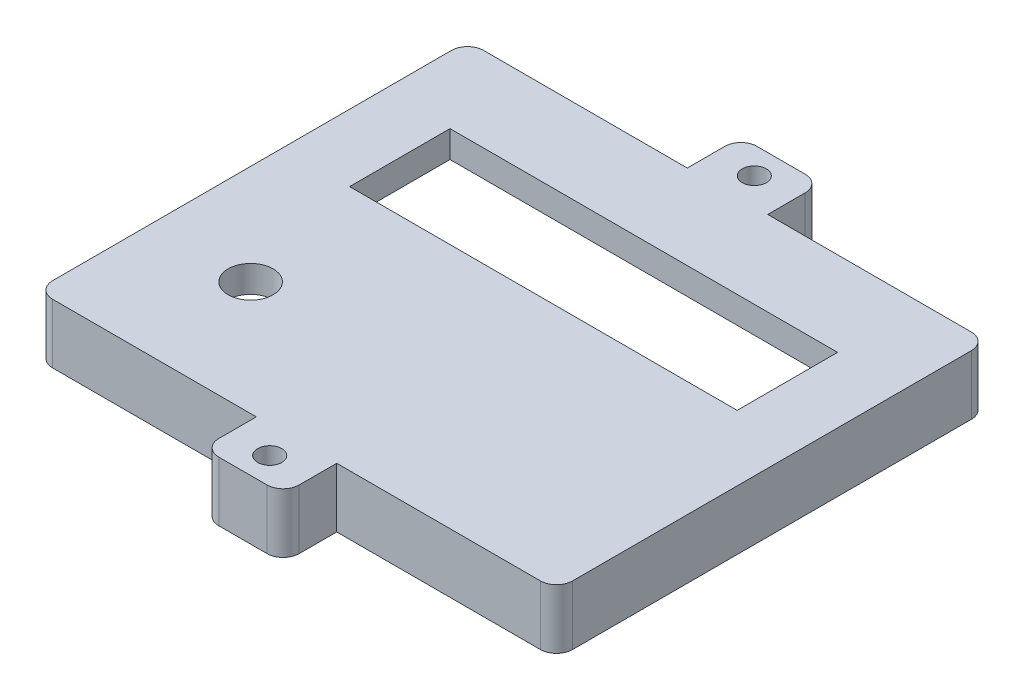
from build123d import *

# Parameters (mm, degrees)
SKETCH1_W           = 97
SKETCH1_H           = 80.401218893
BOSS_EXTRUDE1_DEPTH = 12.6
CUT_EXTRUDE1_REACH  = 69.973
SKETCH2_R           = 4.2
SKETCH2_W           = 72.3
SKETCH2_H           = 18.735180651
CUT_EXTRUDE2_START  = -5
CUT_EXTRUDE2_DEPTH  = 10
SKETCH6_W           = 97
SKETCH6_H           = 80.401218893
CUT_EXTRUDE3_DEPTH  = 1.5
FILLET1_R           = 3
SKETCH7_W           = 15
SKETCH7_H           = 11.1
BOSS_EXTRUDE2_DEPTH = 10
FILLET2_R           = 3
SKETCH8_W           = 15
SKETCH8_H           = 11.1
BOSS_EXTRUDE3_DEPTH = 10
FILLET3_R           = 3
CUT_EXTRUDE4_REACH  = 76.569
SKETCH9_R           = 2.25


with BuildPart() as part:
    # Sketch1 → Boss-Extrude1 (new body)
    with BuildSketch(Plane(origin=(0, 0, 0), x_dir=(1, 0, 0), z_dir=(0, 1, 0))):
        with Locations((3.433898335, -1.804923378)):
            Rectangle(SKETCH1_W, SKETCH1_H)
    extrude(amount=BOSS_EXTRUDE1_DEPTH)

    # Sketch2 → Cut-Extrude1 (cut, up to next)
    with BuildSketch(Plane(origin=(0, 12.6, 0), x_dir=(1, 0, 0), z_dir=(0, 1, 0)), mode=Mode.PRIVATE) as cut_extrude1_sk1:
        with Locations((-26.416101665, -20.718350566)):
            Circle(SKETCH2_R)
    cut_extrude1_tool1 = extrude(cut_extrude1_sk1.sketch, amount=-CUT_EXTRUDE1_REACH, mode=Mode.PRIVATE) & part.part
    # Sketch2 → Cut-Extrude1 (cut, up to next)
    with BuildSketch(Plane(origin=(0, 12.6, 0), x_dir=(1, 0, 0), z_dir=(0, 1, 0)), mode=Mode.PRIVATE) as cut_extrude1_sk2:
        with Locations((3.583898335, 13.264059108)):
            Rectangle(SKETCH2_W, SKETCH2_H)
    cut_extrude1_tool2 = extrude(cut_extrude1_sk2.sketch, amount=-CUT_EXTRUDE1_REACH, mode=Mode.PRIVATE) & part.part
    add(cut_extrude1_tool1.solids().sort_by_distance((-26.416102, 12.6, 20.718351))[0], mode=Mode.SUBTRACT)
    add(cut_extrude1_tool2.solids().sort_by_distance((3.583898, 12.6, -13.264059))[0], mode=Mode.SUBTRACT)

    # Sketch3 → Cut-Extrude2 (cut)
    with BuildSketch(Plane(origin=(0, 12.6, 0), x_dir=(1, 0, 0), z_dir=(0, 1, 0)).offset(CUT_EXTRUDE2_START)):
        with BuildLine():
            Line((-41.366101665, 31.831649434), (-41.366101665, -34.168350566))
            ThreePointArc((-41.366101665, -34.168350566), (-40.926761836, -35.229010737), (-39.866101665, -35.668350566))
            Line((-39.866101665, -35.668350566), (46.133898335, -35.668350566))
            ThreePointArc((46.133898335, -35.668350566), (47.194558507, -35.229010737), (47.633898335, -34.168350566))
            Line((47.633898335, -34.168350566), (47.633898335, 31.831649434))
            ThreePointArc((47.633898335, 31.831649434), (47.194558507, 32.892309606), (46.133898335, 33.331649434))
            Line((46.133898335, 33.331649434), (-39.866101665, 33.331649434))
            ThreePointArc((-39.866101665, 33.331649434), (-40.926761836, 32.892309606), (-41.366101665, 31.831649434))
        make_face()
    extrude(amount=-CUT_EXTRUDE2_DEPTH, mode=Mode.SUBTRACT)

    # Sketch6 → Cut-Extrude3 (cut)
    with BuildSketch(Plane.XZ):
        with Locations((3.433898335, 1.804923378)):
            Rectangle(SKETCH6_W, SKETCH6_H)
        with BuildLine():
            Line((-39.866101665, -34.531649434), (46.133898335, -34.531649434))
            ThreePointArc((46.133898335, -34.531649434), (48.043086645, -33.740837743), (48.833898335, -31.831649434))
            Line((48.833898335, -31.831649434), (48.833898335, 34.168350566))
            ThreePointArc((48.833898335, 34.168350566), (48.043086645, 36.077538875), (46.133898335, 36.868350566))
            Line((46.133898335, 36.868350566), (-39.866101665, 36.868350566))
            ThreePointArc((-39.866101665, 36.868350566), (-41.775289974, 36.077538875), (-42.566101665, 34.168350566))
            Line((-42.566101665, 34.168350566), (-42.566101665, -31.831649434))
            ThreePointArc((-42.566101665, -31.831649434), (-41.775289974, -33.740837743), (-39.866101665, -34.531649434))
        make_face(mode=Mode.SUBTRACT)
    extrude(amount=-CUT_EXTRUDE3_DEPTH, mode=Mode.SUBTRACT)

    # Fillet1
    fillet1_edges = [part.edges().sort_by_distance(p)[0] for p in [
        (51.933898335, 7.05, -38.395686068),
        (-45.066101665, 7.05, -38.395686068),
        (-45.066101665, 7.05, 42.005532825),
        (51.933898335, 7.05, 42.005532825),
    ]]
    fillet(fillet1_edges, radius=FILLET1_R)

    # Sketch7 → Boss-Extrude2 (add)
    with BuildSketch(Plane.XY.offset(42.005532825)):
        with Locations((3.433898335, 7.05)):
            Rectangle(SKETCH7_W, SKETCH7_H)
    extrude(amount=BOSS_EXTRUDE2_DEPTH)

    # Fillet2
    fillet2_edges = [part.edges().sort_by_distance(p)[0] for p in [
        (10.933898335, 7.05, 52.005532825),
        (-4.066101665, 7.05, 52.005532825),
    ]]
    fillet(fillet2_edges, radius=FILLET2_R)

    # Sketch8 → Boss-Extrude3 (add)
    with BuildSketch(Plane(origin=(0, 0, -38.395686068), x_dir=(-1, 0, 0), z_dir=(0, 0, -1))):
        with Locations((-3.433898335, 7.05)):
            Rectangle(SKETCH8_W, SKETCH8_H)
    extrude(amount=BOSS_EXTRUDE3_DEPTH)

    # Fillet3
    fillet3_edges = [part.edges().sort_by_distance(p)[0] for p in [
        (10.933898335, 7.05, -48.395686068),
        (-4.066101665, 7.05, -48.395686068),
    ]]
    fillet(fillet3_edges, radius=FILLET3_R)

    # Sketch9 → Cut-Extrude4 (cut, up to next)
    with BuildSketch(Plane(origin=(0, 12.6, 0), x_dir=(1, 0, 0), z_dir=(0, 1, 0)), mode=Mode.PRIVATE) as cut_extrude4_sk1:
        with Locations((3.433898335, 43.395686068)):
            Circle(SKETCH9_R)
    cut_extrude4_tool1 = extrude(cut_extrude4_sk1.sketch, amount=-CUT_EXTRUDE4_REACH, mode=Mode.PRIVATE) & part.part
    # Sketch9 → Cut-Extrude4 (cut, up to next)
    with BuildSketch(Plane(origin=(0, 12.6, 0), x_dir=(1, 0, 0), z_dir=(0, 1, 0)), mode=Mode.PRIVATE) as cut_extrude4_sk2:
        with Locations((3.433898335, -47.005532825)):
            Circle(SKETCH9_R)
    cut_extrude4_tool2 = extrude(cut_extrude4_sk2.sketch, amount=-CUT_EXTRUDE4_REACH, mode=Mode.PRIVATE) & part.part
    add(cut_extrude4_tool1.solids().sort_by_distance((3.433898, 12.6, -43.395686))[0], mode=Mode.SUBTRACT)
    add(cut_extrude4_tool2.solids().sort_by_distance((3.433898, 12.6, 47.005533))[0], mode=Mode.SUBTRACT)


solid = part.part
